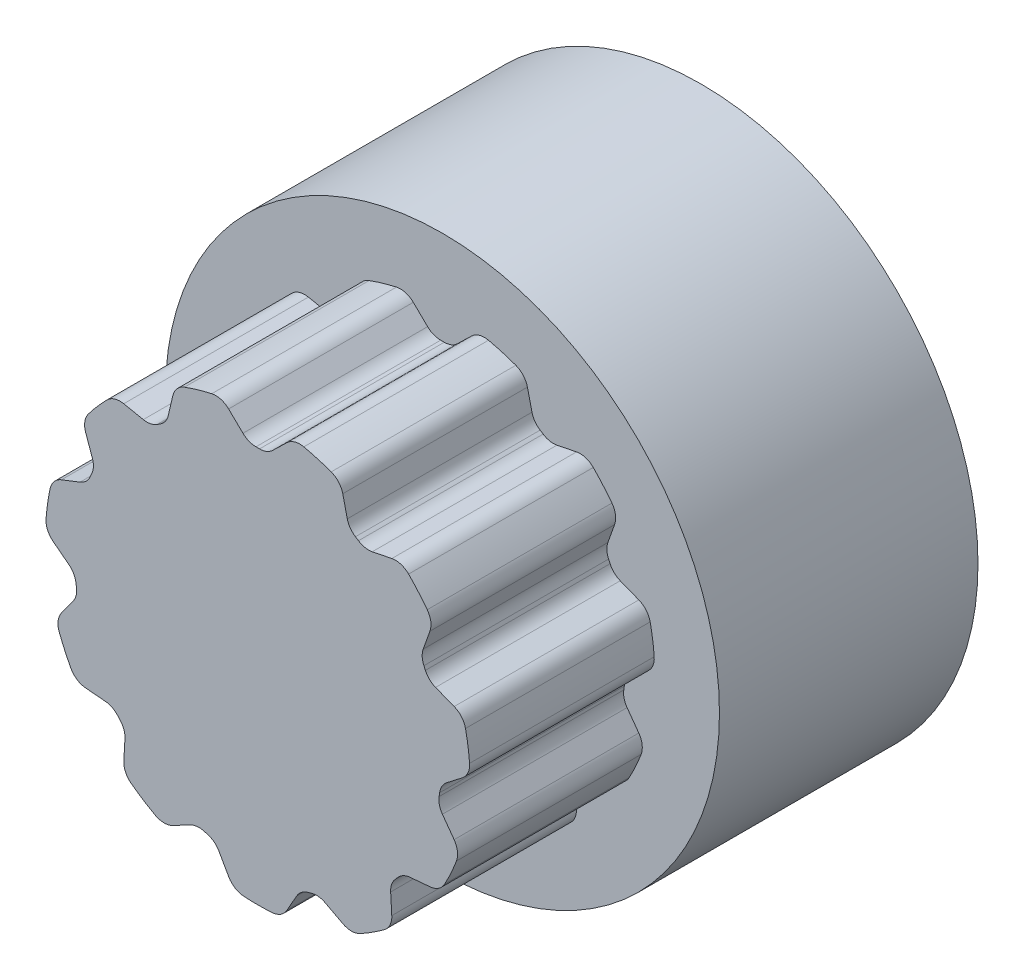
from build123d import *

# Parameters (mm, degrees)
SKETCH2_R                = 5.75
BOSS_EXTRUDE1_DEPTH      = 5
SKETCH3_R                = 7.5
BOSS_EXTRUDE2_DEPTH      = 7
CUT_EXTRUDE2_DEPTH       = 5
FILLET1_R                = 0.5
CIRPATTERN2_COUNT        = 11
FILLET1_OF_CIRPATTERN2_R = 0.5
SKETCH8_R                = 5.875000000000001
CUT_EXTRUDE3_DEPTH       = 6
BOSS_EXTRUDE3_START      = 6
BOSS_EXTRUDE3_DEPTH      = 6
FILLET2_R                = 0.5
CIRPATTERN3_COUNT        = 11
FILLET2_OF_CIRPATTERN3_R = 0.5


with BuildPart() as part:
    # Sketch2 → Boss-Extrude1 (new body)
    with BuildSketch(Plane.XY):
        Circle(SKETCH2_R)
    extrude(amount=BOSS_EXTRUDE1_DEPTH)

    # Sketch3 → Boss-Extrude2 (add)
    with BuildSketch(Plane(origin=(0, 0, 0), x_dir=(-1, 0, 0), z_dir=(0, 0, -1))):
        Circle(SKETCH3_R)
    extrude(amount=BOSS_EXTRUDE2_DEPTH)

    # Sketch7 → Cut-Extrude2 (cut)
    with BuildSketch(Plane.XY.offset(5)):
        with BuildLine():
            Line((-0.25, 4.9607754481289135), (-1, 5.68776098302311))
            ThreePointArc((-1, 5.68776098302311), (3.5e-16, 5.775000000000001), (1, 5.68776098302311))
            Line((1, 5.68776098302311), (0.25, 4.9607754481289135))
            ThreePointArc((0.25, 4.9607754481289135), (3e-16, 4.967070871928306), (-0.25, 4.9607754481289135))
        make_face()
    cut_extrude2 = extrude(amount=-CUT_EXTRUDE2_DEPTH, mode=Mode.SUBTRACT)

    # Fillet1
    fillet1_edges = [part.edges().sort_by_distance(p)[0] for p in [
        (-0.9778082195695803, 5.666250178534492, 2.5),
        (-0.25000000000000006, 4.9607754481289135, 2.5),
        (0.9778082195695803, 5.666250178534492, 2.5),
        (0.25, 4.9607754481289135, 2.5),
    ]]
    fillet(fillet1_edges, radius=FILLET1_R)

    # CirPattern2: Cut-Extrude2 ×11 about axis
    cirpattern2_axis = Axis((1.6e-16, 7e-17, 0), (0, 0, 1))
    for i in range(1, CIRPATTERN2_COUNT):
        add(cut_extrude2.rotate(cirpattern2_axis, i * 360 / CIRPATTERN2_COUNT), mode=Mode.SUBTRACT)

    # Fillet1 of CirPattern2
    fillet1_of_cirpattern2_edges = [part.edges().sort_by_distance(p)[0] for p in [
        (-3.88599074757509, 4.238109945454552, 2.5),
        (-2.8923110766978697, 4.038109666956736, 2.5),
        (-2.2408215092865365, 5.295396015740353, 2.5),
        (-2.4716843102822788, 4.308430075684534, 2.5),
        (-5.560398670324075, 1.464399749746721, 2.5),
        (-4.61633382263768, 1.8333725984452818, 2.5),
        (-4.7480062418323765, 3.2432910334289735, 2.5),
        (-4.408626316136736, 2.288188596122541, 2.5),
        (-5.469419303144769, -1.7742470195514994, 2.5),
        (-4.87470319734617, -0.9534473160807837, 2.5),
        (-5.747732540405436, 0.16146406400327976, 2.5),
        (-4.945860616482813, -0.45853659514031725, 2.5),
        (-3.641937952287114, -4.449582896372505, 2.5),
        (-3.5853887499041597, -3.437554444488015, 2.5),
        (-4.92259436893725, -2.971626604892894, 2.5),
        (-3.912819116876802, -3.0596796573108858, 2.5),
        (-0.6581670342822179, -5.71220764284564, 2.5),
        (-1.1577387075139252, -4.830262325369358, 2.5),
        (-2.5345672667212455, -5.161246823245832, 2.5),
        (-1.637485194321174, -4.6893960469486435, 2.5),
        (2.534567266721245, -5.161246823245832, 2.5),
        (1.6374851943211732, -4.689396046948644, 2.5),
        (0.6581670342822171, -5.71220764284564, 2.5),
        (1.1577387075139245, -4.830262325369359, 2.5),
        (4.922594368937249, -2.971626604892895, 2.5),
        (3.9128191168768023, -3.0596796573108866, 2.5),
        (3.641937952287113, -4.449582896372506, 2.5),
        (3.5853887499041592, -3.4375544444880157, 2.5),
        (5.747732540405436, 0.1614640640032801, 2.5),
        (4.945860616482813, -0.45853659514031697, 2.5),
        (5.469419303144769, -1.7742470195514992, 2.5),
        (4.87470319734617, -0.9534473160807834, 2.5),
        (4.748006241832376, 3.2432910334289757, 2.5),
        (4.408626316136736, 2.288188596122543, 2.5),
        (5.560398670324074, 1.4643997497467234, 2.5),
        (4.61633382263768, 1.8333725984452844, 2.5),
        (2.240821509286541, 5.295396015740351, 2.5),
        (2.4716843102822823, 4.308430075684532, 2.5),
        (3.8859907475750934, 4.238109945454549, 2.5),
        (2.8923110766978724, 4.038109666956732, 2.5),
    ]]
    fillet(fillet1_of_cirpattern2_edges, radius=FILLET1_OF_CIRPATTERN2_R)

    # Sketch8 → Cut-Extrude3 (cut)
    with BuildSketch(Plane(origin=(0, 0, -7), x_dir=(-1, 0, 0), z_dir=(0, 0, -1))):
        Circle(SKETCH8_R)
    extrude(amount=-CUT_EXTRUDE3_DEPTH, mode=Mode.SUBTRACT)

    # Sketch9 → Boss-Extrude3 (add)
    with BuildSketch(Plane(origin=(0, 0, -1), x_dir=(-1, 0, 0), z_dir=(0, 0, -1)).offset(BOSS_EXTRUDE3_START)):
        with BuildLine():
            Line((-0.19999999999999998, 5.060775448128912), (-0.95, 5.797682726745229))
            ThreePointArc((-0.95, 5.797682726745229), (3.6e-16, 5.875), (0.95, 5.797682726745229))
            Line((0.95, 5.797682726745229), (0.19999999999999998, 5.060775448128912))
            ThreePointArc((0.19999999999999998, 5.060775448128912), (3.1e-16, 5.064725869816094), (-0.19999999999999998, 5.060775448128912))
        make_face()
    boss_extrude3 = extrude(amount=-BOSS_EXTRUDE3_DEPTH)

    # Fillet2
    # the kernel refuses this fillet: 0.5 mm, written as the material it adds along each edge
    with BuildSketch(Plane(origin=(-0.95, 5.797682726745229, -7), x_dir=(0.7133054433330211, -0.7008532974249905, 0), z_dir=(0, 0, 1))) as fillet2_piece_1:
        with BuildLine():
            CenterArc((0.26084700321358534, -0.5000000000000001), FILLET2_R, 90.00000000000006, 56.4610445923696)
            ThreePointArc((-0.15590818045302784, -0.22374809161381795), (-0.07925252617904341, -0.11096929267434102), (0, 0))
            Line((0, 0), (0.26084700321358484, 0))
        make_face()
    extrude(amount=6.681774198475012)
    with BuildSketch(Plane(origin=(0.95, 5.797682726745229, -7), x_dir=(-0.7133054433330213, -0.7008532974249906, 0), z_dir=(0, 0, 1))) as fillet2_piece_2:
        with BuildLine():
            CenterArc((0.2608470032135866, 0.5000000000000002), FILLET2_R, 213.5389554076304, 56.46104459236955)
            ThreePointArc((-0.15590818045302646, 0.22374809161381784), (-0.07925252617904295, 0.11096929267434057), (0, 0))
            Line((0, 0), (0.26084700321358617, 1e-17))
        make_face()
    extrude(amount=6.681774198475011)
    # the kernel refuses this fillet: 0.5 mm, written as the material it takes off along each edge
    with BuildSketch(Plane(origin=(-0.19999999999999996, 5.060775448128912, -7.525422641997479), x_dir=(0.9998058914619656, 0.01970226885269653, 0), z_dir=(0, 0, 1))) as fillet2_2_piece_1:
        with BuildLine():
            CenterArc((0.21040196163523422, 0.49990203737914873), FILLET2_R, 224.37556577683083, 44.490233507803396)
            Line((-0.1469835340821104, 0.15022274509710942), (0, 0))
            ThreePointArc((0, 0), (0.10025241981021557, 0.00099230764019776), (0.20050483962043109, 0))
        make_face()
    extrude(amount=6.525422641997479, mode=Mode.SUBTRACT)
    with BuildSketch(Plane(origin=(0.20000000000000057, 5.060775448128913, -7.525422641997476), x_dir=(0.7133054433330216, 0.7008532974249899, 0), z_dir=(0, 0, 1))) as fillet2_2_piece_2:
        with BuildLine():
            CenterArc((0.21016905679899264, 0.5), FILLET2_R, 225.50976649219658, 44.490233507803396)
            ThreePointArc((-0.14022478083519202, 0.14331504300294873), (-0.06940311770180428, 0.07235150036817459), (0, 0))
            Line((0, 0), (0.21016905679899253, 1e-17))
        make_face()
    extrude(amount=6.525422641997476, mode=Mode.SUBTRACT)

    # CirPattern3: Boss-Extrude3 ×11 about axis
    cirpattern3_axis = Axis((-3e-17, 9e-17, 0), (0, 0, 1))
    for i in range(1, CIRPATTERN3_COUNT):
        add(boss_extrude3.rotate(cirpattern3_axis, i * 360 / CIRPATTERN3_COUNT))

    # Fillet2 of CirPattern3
    # the kernel refuses this fillet: 0.5 mm, written as the material it adds along each edge
    with BuildSketch(Plane(origin=(-3.933654784925361, 4.363712299525922, -7), x_dir=(0.978980623827914, -0.20395327447606323, 0), z_dir=(0, 0, 1))) as fillet2_of_cirpattern3_piece_1:
        with BuildLine():
            CenterArc((0.26084700321358584, -0.4999999999999999), FILLET2_OF_CIRPATTERN3_R, 89.99999999999999, 56.46104459236959)
            ThreePointArc((-0.15590818045302687, -0.22374809161381728), (-0.07925252617904359, -0.11096929267434076), (0, 0))
            Line((0, 0), (0.26084700321358595, 0))
        make_face()
    extrude(amount=6.68177419847501)
    with BuildSketch(Plane(origin=(-2.3352730725461166, 5.390929852691558, -7), x_dir=(0.9265834580543744, 0.37608921183676286, 0), z_dir=(0, 0, 1))) as fillet2_of_cirpattern3_piece_2:
        with BuildLine():
            CenterArc((0.26110501218191773, -0.4998653135585517), FILLET2_OF_CIRPATTERN3_R, 88.67008367603637, 56.46104459236949)
            Line((-0.14912628601456845, -0.2140152095179448), (0, 0))
            ThreePointArc((0, 0), (0.13635483969500206, 0.00158256568701401), (0.27270967939000296, 1e-17))
        make_face()
    extrude(amount=6.681774198475007)
    with BuildSketch(Plane(origin=(-5.6684019695134795, 1.5442940497248896, -7), x_dir=(0.9338363734039905, 0.3577004720540398, 0), z_dir=(0, 0, 1))) as fillet2_of_cirpattern3_piece_3:
        with BuildLine():
            CenterArc((0.2608470032135847, -0.5), FILLET2_OF_CIRPATTERN3_R, 89.99999999999989, 56.461044592369575)
            ThreePointArc((-0.15590818045302762, -0.2237480916138164), (-0.07925252617904321, -0.11096929267434057), (0, 0))
            Line((0, 0), (0.2608470032135857, 0))
        make_face()
    extrude(amount=6.68177419847501)
    with BuildSketch(Plane(origin=(-4.879113444809895, 3.272594840898474, -7), x_dir=(0.5761624286275111, 0.817335216320726, 0), z_dir=(0, 0, 1))) as fillet2_of_cirpattern3_piece_4:
        with BuildLine():
            CenterArc((0.2611050121819153, -0.4998653135585519), FILLET2_OF_CIRPATTERN3_R, 88.67008367603596, 56.46104459236959)
            Line((-0.14912628601456912, -0.21401520951794295), (0, 0))
            ThreePointArc((0, 0), (0.1363548396950014, 0.00158256568701406), (0.27270967939000407, 0))
        make_face()
    extrude(amount=6.68177419847501)
    with BuildSketch(Plane(origin=(-5.60347157979552, -1.7654266494034527, -7), x_dir=(0.5922056725968166, 0.8057868460977456, 0), z_dir=(0, 0, 1))) as fillet2_of_cirpattern3_piece_5:
        with BuildLine():
            CenterArc((0.2608470032135869, -0.5000000000000002), FILLET2_OF_CIRPATTERN3_R, 90, 56.46104459236943)
            ThreePointArc((-0.15590818045302532, -0.22374809161381634), (-0.07925252617904405, -0.11096929267434179), (0, 0))
            Line((0, 0), (0.2608470032135869, 0))
        make_face()
    extrude(amount=6.681774198475006)
    with BuildSketch(Plane(origin=(-5.8738697725147615, 0.11523409017031919, -7), x_dir=(0.04281389908060448, 0.9990830646375284, 0), z_dir=(0, 0, 1))) as fillet2_of_cirpattern3_piece_6:
        with BuildLine():
            CenterArc((0.26110501218191634, -0.4998653135585516), FILLET2_OF_CIRPATTERN3_R, 88.67008367603616, 56.46104459236959)
            Line((-0.14912628601456912, -0.21401520951794414), (0, 0))
            ThreePointArc((0, 0), (0.13635483969500173, 0.00158256568701392), (0.27270967939000346, 0))
        make_face()
    extrude(amount=6.681774198475008)
    with BuildSketch(Plane(origin=(-3.7594785557307224, -4.514636861254827, -7), x_dir=(0.06255385506548457, 0.9980415899232088, 0), z_dir=(0, 0, 1))) as fillet2_of_cirpattern3_piece_7:
        with BuildLine():
            CenterArc((0.26084700321358434, -0.5), FILLET2_OF_CIRPATTERN3_R, 90.00000000000001, 56.46104459236925)
            ThreePointArc((-0.15590818045302704, -0.22374809161381495), (-0.07925252617904416, -0.11096929267434168), (0, 0))
            Line((0, 0), (0.2608470032135843, 0))
        make_face()
    extrude(amount=6.681774198475006)
    with BuildSketch(Plane(origin=(-5.003713950226763, -3.0787126699817366, -7), x_dir=(-0.5041277409158409, 0.8636290991155235, 0), z_dir=(0, 0, 1))) as fillet2_of_cirpattern3_piece_8:
        with BuildLine():
            CenterArc((0.26110501218191545, -0.49986531355855207), FILLET2_OF_CIRPATTERN3_R, 88.67008367603616, 56.46104459236942)
            Line((-0.14912628601456915, -0.21401520951794312), (0, 0))
            ThreePointArc((0, 0), (0.13635483969499837, 0.00158256568701384), (0.27270967939000257, 1e-17))
        make_face()
    extrude(amount=6.681774198475007)
    with BuildSketch(Plane(origin=(-0.721877653427555, -5.830481768557545, -7), x_dir=(-0.48695836946471915, 0.873425180772951, 0), z_dir=(0, 0, 1))) as fillet2_of_cirpattern3_piece_9:
        with BuildLine():
            CenterArc((0.2608470032135852, -0.49999999999999994), FILLET2_OF_CIRPATTERN3_R, 89.99999999999993, 56.46104459236987)
            ThreePointArc((-0.15590818045302882, -0.22374809161381876), (-0.0792525261790464, -0.11096929267434513), (0, 0))
            Line((0, 0), (0.26084700321358595, 1e-17))
        make_face()
    extrude(amount=6.681774198475017)
    with BuildSketch(Plane(origin=(-2.5449143032950996, -5.295189910558829, -7), x_dir=(-0.8910123851679101, 0.4539789967359631, 0), z_dir=(0, 0, 1))) as fillet2_of_cirpattern3_piece_10:
        with BuildLine():
            CenterArc((0.26110501218191784, -0.4998653135585523), FILLET2_OF_CIRPATTERN3_R, 88.6700836760363, 56.46104459236936)
            Line((-0.14912628601456762, -0.214015209517944), (0, 0))
            ThreePointArc((0, 0), (0.1363548396949998, 0.00158256568701348), (0.2727096793900037, 0))
        make_face()
    extrude(amount=6.68177419847501)
    with BuildSketch(Plane(origin=(2.5449143032950987, -5.29518991055883, -7), x_dir=(-0.8818647523732984, 0.47150244805470637, 0), z_dir=(0, 0, 1))) as fillet2_of_cirpattern3_piece_11:
        with BuildLine():
            CenterArc((0.2608470032135851, -0.5000000000000002), FILLET2_OF_CIRPATTERN3_R, 89.99999999999991, 56.46104459236935)
            ThreePointArc((-0.1559081804530262, -0.223748091613815), (-0.07925252617904315, -0.11096929267434097), (0, 0))
            Line((0, 0), (0.26084700321358595, 1e-17))
        make_face()
    extrude(amount=6.681774198475004)
    with BuildSketch(Plane(origin=(0.7218776534275536, -5.830481768557546, -7), x_dir=(-0.9950068927218445, -0.09980622944495912, 0), z_dir=(0, 0, 1))) as fillet2_of_cirpattern3_piece_12:
        with BuildLine():
            CenterArc((0.26110501218191573, -0.49986531355855246), FILLET2_OF_CIRPATTERN3_R, 88.67008367603616, 56.46104459236973)
            Line((-0.14912628601457037, -0.2140152095179458), (0, 0))
            ThreePointArc((0, 0), (0.13635483969499856, 0.00158256568701379), (0.27270967939000273, 0))
        make_face()
    extrude(amount=6.681774198475007)
    with BuildSketch(Plane(origin=(5.0037139502267625, -3.078712669981738, -7), x_dir=(-0.9967853073619442, -0.08011898044380343, 0), z_dir=(0, 0, 1))) as fillet2_of_cirpattern3_piece_13:
        with BuildLine():
            CenterArc((0.26084700321358506, -0.49999999999999994), FILLET2_OF_CIRPATTERN3_R, 90.00000000000009, 56.46104459236943)
            ThreePointArc((-0.15590818045302776, -0.22374809161381648), (-0.07925252617904316, -0.11096929267434111), (0, 0))
            Line((0, 0), (0.26084700321358434, 0))
        make_face()
    extrude(amount=6.68177419847501)
    with BuildSketch(Plane(origin=(3.759478555730721, -4.514636861254829, -7), x_dir=(-0.7830937422193456, -0.6219036829742218, 0), z_dir=(0, 0, 1))) as fillet2_of_cirpattern3_piece_14:
        with BuildLine():
            CenterArc((0.26110501218191723, -0.49986531355855185), FILLET2_OF_CIRPATTERN3_R, 88.6700836760363, 56.46104459236939)
            Line((-0.14912628601456795, -0.21401520951794387), (0, 0))
            ThreePointArc((0, 0), (0.13635483969499929, 0.00158256568701402), (0.272709679390003, 0))
        make_face()
    extrude(amount=6.681774198475007)
    with BuildSketch(Plane(origin=(5.8738697725147615, 0.11523409017031912, -7), x_dir=(-0.7952335702116019, -0.6063031987450743, 0), z_dir=(0, 0, 1))) as fillet2_of_cirpattern3_piece_15:
        with BuildLine():
            CenterArc((0.2608470032135849, -0.49999999999999994), FILLET2_OF_CIRPATTERN3_R, 89.99999999999987, 56.461044592369674)
            ThreePointArc((-0.15590818045302737, -0.22374809161381712), (-0.07925252617904394, -0.11096929267434101), (0, 0))
            Line((0, 0), (0.26084700321358606, 0))
        make_face()
    extrude(amount=6.68177419847501)
    with BuildSketch(Plane(origin=(5.60347157979552, -1.765426649403453, -7), x_dir=(-0.32255386163818256, -0.9465511113206176, 0), z_dir=(0, 0, 1))) as fillet2_of_cirpattern3_piece_16:
        with BuildLine():
            CenterArc((0.2611050121819176, -0.4998653135585517), FILLET2_OF_CIRPATTERN3_R, 88.67008367603611, 56.46104459236955)
            Line((-0.1491262860145677, -0.21401520951794348), (0, 0))
            ThreePointArc((0, 0), (0.1363548396950015, 0.0015825656870131), (0.27270967939000507, -1e-17))
        make_face()
    extrude(amount=6.681774198475012)
    with BuildSketch(Plane(origin=(4.879113444809895, 3.272594840898476, -7), x_dir=(-0.3412007933709823, -0.9399904353784734, 0), z_dir=(0, 0, 1))) as fillet2_of_cirpattern3_piece_17:
        with BuildLine():
            CenterArc((0.2608470032135843, -0.4999999999999998), FILLET2_OF_CIRPATTERN3_R, 89.99999999999991, 56.46104459236963)
            ThreePointArc((-0.15590818045302837, -0.22374809161381679), (-0.07925252617904381, -0.11096929267434161), (0, 0))
            Line((0, 0), (0.2608470032135851, 1e-17))
        make_face()
    extrude(amount=6.681774198475011)
    with BuildSketch(Plane(origin=(5.6684019695134795, 1.5442940497248916, -7), x_dir=(0.24039459095642207, -0.9706752498332768, 0), z_dir=(0, 0, 1))) as fillet2_of_cirpattern3_piece_18:
        with BuildLine():
            CenterArc((0.2611050121819157, -0.49986531355855224), FILLET2_OF_CIRPATTERN3_R, 88.67008367603617, 56.46104459236955)
            Line((-0.14912628601456945, -0.21401520951794456), (0, 0))
            ThreePointArc((0, 0), (0.13635483969500103, 0.00158256568701384), (0.27270967939000257, 0))
        make_face()
    extrude(amount=6.681774198475007)
    with BuildSketch(Plane(origin=(2.3352730725461206, 5.3909298526915554, -7), x_dir=(-0.9265834580543721, 0.37608921183676847, 0), z_dir=(0, 0, 1))) as fillet2_of_cirpattern3_piece_19:
        with BuildLine():
            CenterArc((0.26110501218191584, 0.4998653135585518), FILLET2_OF_CIRPATTERN3_R, 214.86887173159437, 56.46104459236955)
            Line((-0.14912628601456898, 0.21401520951794328), (0, 0))
            ThreePointArc((0, 0), (0.1363548396950021, -0.00158256568701319), (0.27270967939000357, -1e-17))
        make_face()
    extrude(amount=6.68177419847501)
    with BuildSketch(Plane(origin=(3.933654784925364, 4.363712299525919, -7), x_dir=(0.727019459469375, -0.6866168549874506, 0), z_dir=(0, 0, 1))) as fillet2_of_cirpattern3_piece_20:
        with BuildLine():
            CenterArc((0.26110501218191695, -0.49986531355855196), FILLET2_OF_CIRPATTERN3_R, 88.6700836760362, 56.46104459236949)
            Line((-0.14912628601456804, -0.21401520951794417), (0, 0))
            ThreePointArc((0, 0), (0.13635483969500198, 0.00158256568701391), (0.2727096793900036, 1e-17))
        make_face()
    extrude(amount=6.68177419847501)
    # the kernel refuses this fillet: 0.5 mm, written as the material it takes off along each edge
    with BuildSketch(Plane(origin=(-2.9043124818018704, 4.149267061112631, -7.525422641997486), x_dir=(0.8304383875995578, 0.5571104777340365, 0), z_dir=(0, 0, 1))) as fillet2_of_cirpattern3_2_piece_1:
        with BuildLine():
            CenterArc((0.21040196163523095, 0.499902037379149), FILLET2_OF_CIRPATTERN3_R, 224.37556577683097, 44.49023350780351)
            Line((-0.1469835340821126, 0.15022274509710873), (0, 0))
            ThreePointArc((0, 0), (0.1002524198102146, 0.00099230764019822), (0.20050483962043, -2e-17))
        make_face()
    extrude(amount=6.525422641997486, mode=Mode.SUBTRACT)
    with BuildSketch(Plane(origin=(-2.5678110686693967, 4.365523388094872, -7.525422641997482), x_dir=(0.22116082455531866, 0.9752373504342478, 0), z_dir=(0, 0, 1))) as fillet2_of_cirpattern3_2_piece_2:
        with BuildLine():
            CenterArc((0.21016905679899103, 0.5000000000000002), FILLET2_OF_CIRPATTERN3_R, 225.50976649219646, 44.49023350780351)
            ThreePointArc((-0.1402247808351948, 0.14331504300294917), (-0.0694031177018053, 0.07235150036817577), (0, 0))
            Line((0, 0), (0.21016905679899067, 0))
        make_face()
    extrude(amount=6.525422641997482, mode=Mode.SUBTRACT)
    with BuildSketch(Plane(origin=(-4.686526271523037, 1.9203956995131963, -7.525422641997485), x_dir=(0.39741256327155017, 0.9176400462893586, 0), z_dir=(0, 0, 1))) as fillet2_of_cirpattern3_2_piece_3:
        with BuildLine():
            CenterArc((0.21040196163523134, 0.4999020373791491), FILLET2_OF_CIRPATTERN3_R, 224.37556577683102, 44.49023350780345)
            Line((-0.1469835340821119, 0.15022274509710842), (0, 0))
            ThreePointArc((0, 0), (0.10025241981021579, 0.0009923076401984), (0.20050483962043067, 0))
        make_face()
    extrude(amount=6.525422641997485, mode=Mode.SUBTRACT)
    with BuildSketch(Plane(origin=(-4.520360266322282, 2.284248497655004, -7.525422641997483), x_dir=(-0.34120079337098363, 0.939990435378473, 0), z_dir=(0, 0, 1))) as fillet2_of_cirpattern3_2_piece_4:
        with BuildLine():
            CenterArc((0.21016905679899286, 0.49999999999999983), FILLET2_OF_CIRPATTERN3_R, 225.50976649219652, 44.49023350780351)
            ThreePointArc((-0.14022478083519269, 0.1433150430029483), (-0.06940311770180382, 0.07235150036817513), (0, 0))
            Line((0, 0), (0.21016905679899298, 0))
        make_face()
    extrude(amount=6.525422641997483, mode=Mode.SUBTRACT)
    with BuildSketch(Plane(origin=(-4.980801083447926, -0.9181877278140647, -7.525422641997483), x_dir=(-0.1617889419121883, 0.9868253838825461, 0), z_dir=(0, 0, 1))) as fillet2_of_cirpattern3_2_piece_5:
        with BuildLine():
            CenterArc((0.2104019616352321, 0.4999020373791492), FILLET2_OF_CIRPATTERN3_R, 224.37556577683083, 44.49023350780345)
            Line((-0.14698353408211273, 0.15022274509710942), (0, 0))
            ThreePointArc((0, 0), (0.10025241981021492, 0.00099230764019866), (0.2005048396204296, 0))
        make_face()
    extrude(amount=6.525422641997483, mode=Mode.SUBTRACT)
    with BuildSketch(Plane(origin=(-5.03772701875724, -0.522259151061693, -7.525422641997485), x_dir=(-0.7952335702116032, 0.6063031987450728, 0), z_dir=(0, 0, 1))) as fillet2_of_cirpattern3_2_piece_6:
        with BuildLine():
            CenterArc((0.21016905679899586, 0.49999999999999994), FILLET2_OF_CIRPATTERN3_R, 225.50976649219652, 44.49023350780351)
            ThreePointArc((-0.14022478083518922, 0.14331504300294884), (-0.06940311770180232, 0.07235150036817496), (0, 0))
            Line((0, 0), (0.21016905679899603, 0))
        make_face()
    extrude(amount=6.525422641997485, mode=Mode.SUBTRACT)
    with BuildSketch(Plane(origin=(-3.6937067440368496, -3.4652530391648293, -7.525422641997481), x_dir=(-0.6696236011848387, 0.7427006346679988, 0), z_dir=(0, 0, 1))) as fillet2_of_cirpattern3_2_piece_7:
        with BuildLine():
            CenterArc((0.2104019616352319, 0.4999020373791493), FILLET2_OF_CIRPATTERN3_R, 224.37556577683094, 44.49023350780345)
            Line((-0.14698353408211196, 0.1502227450971091), (0, 0))
            ThreePointArc((0, 0), (0.10025241981021567, 0.00099230764019842), (0.20050483962043028, 0))
        make_face()
    extrude(amount=6.525422641997481, mode=Mode.SUBTRACT)
    with BuildSketch(Plane(origin=(-3.9556510376149636, -3.1629532094231263, -7.525422641997479), x_dir=(-0.9967853073619439, 0.08011898044380547, 0), z_dir=(0, 0, 1))) as fillet2_of_cirpattern3_2_piece_8:
        with BuildLine():
            CenterArc((0.21016905679899162, 0.49999999999999994), FILLET2_OF_CIRPATTERN3_R, 225.50976649219666, 44.490233507803396)
            ThreePointArc((-0.14022478083519285, 0.14331504300294767), (-0.06940311770180389, 0.07235150036817428), (0, 0))
            Line((0, 0), (0.21016905679899187, 0))
        make_face()
    extrude(amount=6.525422641997479, mode=Mode.SUBTRACT)
    with BuildSketch(Plane(origin=(-1.2338866118787926, -4.912124994888736, -7.525422641997479), x_dir=(-0.9648574984155814, 0.2627736816182826, 0), z_dir=(0, 0, 1))) as fillet2_of_cirpattern3_2_piece_9:
        with BuildLine():
            CenterArc((0.21040196163523245, 0.49990203737914923), FILLET2_OF_CIRPATTERN3_R, 224.37556577683097, 44.49023350780345)
            Line((-0.1469835340821111, 0.15022274509710895), (0, 0))
            ThreePointArc((0, 0), (0.10025241981021574, 0.00099230764019839), (0.20050483962043142, 0))
        make_face()
    extrude(amount=6.525422641997479, mode=Mode.SUBTRACT)
    with BuildSketch(Plane(origin=(-1.617683801324591, -4.799431972152163, -7.525422641997478), x_dir=(-0.8818647523732976, -0.4715024480547077, 0), z_dir=(0, 0, 1))) as fillet2_of_cirpattern3_2_piece_10:
        with BuildLine():
            CenterArc((0.21016905679899384, 0.5), FILLET2_OF_CIRPATTERN3_R, 225.50976649219658, 44.490233507803396)
            ThreePointArc((-0.14022478083519108, 0.14331504300294845), (-0.06940311770180282, 0.07235150036817568), (0, 0))
            Line((0, 0), (0.21016905679899353, 0))
        make_face()
    extrude(amount=6.525422641997478, mode=Mode.SUBTRACT)
    with BuildSketch(Plane(origin=(1.6176838013245893, -4.799431972152164, -7.525422641997478), x_dir=(-0.9537559572566883, -0.30058205867512794, 0), z_dir=(0, 0, 1))) as fillet2_of_cirpattern3_2_piece_11:
        with BuildLine():
            CenterArc((0.210401961635232, 0.49990203737914907), FILLET2_OF_CIRPATTERN3_R, 224.37556577683094, 44.490233507803396)
            Line((-0.14698353408211196, 0.1502227450971088), (0, 0))
            ThreePointArc((0, 0), (0.10025241981021532, 0.00099230764019799), (0.20050483962043028, 0))
        make_face()
    extrude(amount=6.525422641997478, mode=Mode.SUBTRACT)
    with BuildSketch(Plane(origin=(1.233886611878792, -4.912124994888737, -7.525422641997477), x_dir=(-0.4869583694647189, -0.8734251807729511, 0), z_dir=(0, 0, 1))) as fillet2_of_cirpattern3_2_piece_12:
        with BuildLine():
            CenterArc((0.21016905679898987, 0.5000000000000001), FILLET2_OF_CIRPATTERN3_R, 225.50976649219663, 44.49023350780328)
            ThreePointArc((-0.1402247808351949, 0.14331504300294826), (-0.06940311770180539, 0.07235150036817488), (0, 0))
            Line((0, 0), (0.21016905679898948, 0))
        make_face()
    extrude(amount=6.525422641997477, mode=Mode.SUBTRACT)
    with BuildSketch(Plane(origin=(3.9556510376149627, -3.162953209423127, -7.525422641997482), x_dir=(-0.6398436385863687, -0.768505119150521, 0), z_dir=(0, 0, 1))) as fillet2_of_cirpattern3_2_piece_13:
        with BuildLine():
            CenterArc((0.2104019616352312, 0.49990203737914934), FILLET2_OF_CIRPATTERN3_R, 224.37556577683105, 44.49023350780345)
            Line((-0.14698353408211193, 0.1502227450971087), (0, 0))
            ThreePointArc((0, 0), (0.10025241981021499, 0.00099230764019824), (0.20050483962043064, 1e-17))
        make_face()
    extrude(amount=6.525422641997482, mode=Mode.SUBTRACT)
    with BuildSketch(Plane(origin=(3.6937067440368483, -3.4652530391648315, -7.525422641997481), x_dir=(0.06255385506548619, -0.9980415899232087, 0), z_dir=(0, 0, 1))) as fillet2_of_cirpattern3_2_piece_14:
        with BuildLine():
            CenterArc((0.21016905679899262, 0.5), FILLET2_OF_CIRPATTERN3_R, 225.50976649219658, 44.490233507803396)
            ThreePointArc((-0.14022478083519246, 0.14331504300294845), (-0.0694031177018045, 0.07235150036817482), (0, 0))
            Line((0, 0), (0.21016905679899223, 0))
        make_face()
    extrude(amount=6.525422641997481, mode=Mode.SUBTRACT)
    with BuildSketch(Plane(origin=(5.0377270187572405, -0.5222591510616919, -7.5254226419974835), x_dir=(-0.12278548558398795, -0.9924332342933223, 0), z_dir=(0, 0, 1))) as fillet2_of_cirpattern3_2_piece_15:
        with BuildLine():
            CenterArc((0.21040196163523275, 0.4999020373791489), FILLET2_OF_CIRPATTERN3_R, 224.37556577683088, 44.49023350780345)
            Line((-0.14698353408211143, 0.15022274509710926), (0, 0))
            ThreePointArc((0, 0), (0.1002524198102153, 0.00099230764019795), (0.20050483962043092, 0))
        make_face()
    extrude(amount=6.5254226419974835, mode=Mode.SUBTRACT)
    with BuildSketch(Plane(origin=(4.980801083447926, -0.9181877278140659, -7.525422641997479), x_dir=(0.5922056725968182, -0.8057868460977444, 0), z_dir=(0, 0, 1))) as fillet2_of_cirpattern3_2_piece_16:
        with BuildLine():
            CenterArc((0.21016905679899428, 0.5000000000000002), FILLET2_OF_CIRPATTERN3_R, 225.50976649219646, 44.490233507803396)
            ThreePointArc((-0.1402247808351914, 0.14331504300294934), (-0.06940311770180384, 0.07235150036817534), (0, 0))
            Line((0, 0), (0.21016905679899323, 0))
        make_face()
    extrude(amount=6.525422641997479, mode=Mode.SUBTRACT)
    with BuildSketch(Plane(origin=(4.520360266322282, 2.284248497655005, -7.525422641997483), x_dir=(0.4332561915305223, -0.9012708097461425, 0), z_dir=(0, 0, 1))) as fillet2_of_cirpattern3_2_piece_17:
        with BuildLine():
            CenterArc((0.21040196163523214, 0.49990203737914934), FILLET2_OF_CIRPATTERN3_R, 224.37556577683094, 44.49023350780345)
            Line((-0.14698353408211154, 0.15022274509710934), (0, 0))
            ThreePointArc((0, 0), (0.10025241981021508, 0.00099230764019806), (0.20050483962043059, 1e-17))
        make_face()
    extrude(amount=6.525422641997483, mode=Mode.SUBTRACT)
    with BuildSketch(Plane(origin=(4.686526271523037, 1.9203956995131972, -7.525422641997479), x_dir=(0.9338363734039915, -0.35770047205403704, 0), z_dir=(0, 0, 1))) as fillet2_of_cirpattern3_2_piece_18:
        with BuildLine():
            CenterArc((0.2101690567989927, 0.5), FILLET2_OF_CIRPATTERN3_R, 225.50976649219658, 44.490233507803396)
            ThreePointArc((-0.1402247808351924, 0.14331504300294817), (-0.06940311770180436, 0.07235150036817496), (0, 0))
            Line((0, 0), (0.21016905679899223, 0))
        make_face()
    extrude(amount=6.525422641997479, mode=Mode.SUBTRACT)
    with BuildSketch(Plane(origin=(2.5678110686694002, 4.365523388094869, -7.525422641997482), x_dir=(0.8517420890760581, -0.5239612711798003, 0), z_dir=(0, 0, 1))) as fillet2_of_cirpattern3_2_piece_19:
        with BuildLine():
            CenterArc((0.2104019616352326, 0.49990203737914896), FILLET2_OF_CIRPATTERN3_R, 224.37556577683083, 44.49023350780345)
            Line((-0.14698353408211187, 0.15022274509710967), (0, 0))
            ThreePointArc((0, 0), (0.10025241981021565, 0.00099230764019842), (0.20050483962043011, 0))
        make_face()
    extrude(amount=6.525422641997482, mode=Mode.SUBTRACT)
    with BuildSketch(Plane(origin=(2.9043124818018744, 4.14926706111263, -7.52542264199748), x_dir=(0.9789806238279136, 0.2039532744760645, 0), z_dir=(0, 0, 1))) as fillet2_of_cirpattern3_2_piece_20:
        with BuildLine():
            CenterArc((0.2101690567989931, 0.4999999999999998), FILLET2_OF_CIRPATTERN3_R, 225.50976649219652, 44.490233507803396)
            ThreePointArc((-0.14022478083519216, 0.14331504300294867), (-0.06940311770180428, 0.072351500368175), (0, 0))
            Line((0, 0), (0.21016905679899214, 0))
        make_face()
    extrude(amount=6.52542264199748, mode=Mode.SUBTRACT)


solid = part.part
